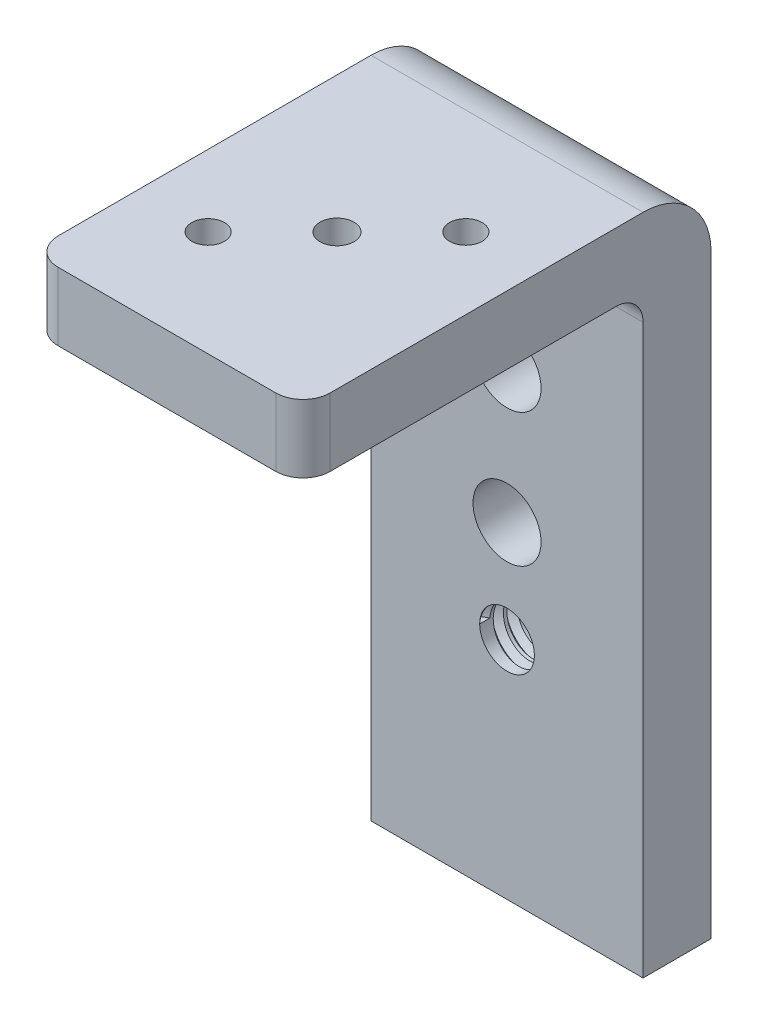
from build123d import *

# Parameters (mm, degrees)
BOSS_EXTRUDE1_DEPTH         = 3.175
SKETCH14_W                  = 25.4
SKETCH14_H                  = 6.35
BOSS_EXTRUDE2_DEPTH         = 31.75
F_1_4_0_25_DIAMETER_HOLE1_D = 6.35
F_1_4_20_TAPPED_HOLE1_D     = 5.1054
THREAD1_PITCH               = 1.27
FILLET1_R                   = 6.35
FILLET2_R                   = 2.54
SKETCH23_R                  = 1.524
CUT_EXTRUDE2_DEPTH          = 73.209440492


with BuildPart() as part:
    # Sketch1 → Boss-Extrude1 (new, symmetric)
    with BuildSketch(Plane.XY):
        Polygon((-12.7, 0), (12.7, 0), (12.7, 42.8625), (12.7, 61.9125), (-12.7, 61.9125), (-12.7, 42.8625), align=None)
    extrude(amount=BOSS_EXTRUDE1_DEPTH, both=True)

    # Sketch14 → Boss-Extrude2 (add)
    with BuildSketch(Plane.XY.offset(3.175)):
        with Locations((0, 58.7375)):
            Rectangle(SKETCH14_W, SKETCH14_H)
    extrude(amount=BOSS_EXTRUDE2_DEPTH)

    # 1/4 (0.25) Diameter Hole1 (through all)
    with Locations(Plane.XY.offset(3.175)):
        with Locations((0, 42.926), (0, 30.48)):
            Hole(F_1_4_0_25_DIAMETER_HOLE1_D / 2)

    # 1/4-20 Tapped Hole1 (through all)
    with Locations(Plane.XY.offset(3.175)):
        with Locations((0, 21.0058)):
            Hole(F_1_4_20_TAPPED_HOLE1_D / 2)

    # Thread1: the profile of Thread Profile1 profile screwed along a right-hand helix of 5 turns, 8 arcs to a turn; built about Z, then put on its axis
    thread1_z = Axis((0, 0, 0), (0, 0, 1))
    thread1_corners = [(2.5524, 0, -0.000173205), (3.240107661, 0, 0.396874998), (3.240107661, 0, 0.555624998), (2.5524, 0, 0.952673202)]
    with BuildLine(mode=Mode.PRIVATE) as thread1_profile:
        Line(thread1_corners[0], thread1_corners[1])
        Line(thread1_corners[1], thread1_corners[2])
        Line(thread1_corners[2], thread1_corners[3])
        Line(thread1_corners[3], thread1_corners[0])
    thread1_cap = Face(thread1_profile.wire())
    thread1_turn_angles = [0, 22.5, 45, 67.5, 90, 112.5, 135, 157.5, 180, 202.5, 225, 247.5, 270, 292.5, 315, 337.5, 360]
    thread1_turn_weights = [1, 0.9238795325112867, 1, 0.9238795325112867, 1, 0.9238795325112867, 1, 0.9238795325112867, 1, 0.9238795325112867, 1, 0.9238795325112867, 1, 0.9238795325112867, 1, 0.9238795325112867, 1]
    thread1_turn_rails = [Edge.make_bspline([Vector(p[0], p[1], 0).rotate(thread1_z, thread1_turn_angles[k]) / thread1_turn_weights[k] + Vector(0, 0, p[2] + THREAD1_PITCH * thread1_turn_angles[k] / 360) for k in range(17)], [0, 0, 0, 1, 1, 2, 2, 3, 3, 4, 4, 5, 5, 6, 6, 7, 7, 8, 8, 8], 2, thread1_turn_weights) for p in thread1_corners]
    thread1_turn_sides = [Face.make_surface_from_curves(thread1_turn_rails[p[0]], thread1_turn_rails[p[1]]) for p in [(0, 1), (1, 2), (2, 3), (3, 0)]]
    thread1 = Plane(origin=(0, 21.0058, 3.175), x_dir=(-1, 0, 0), z_dir=(0, 0, -1)) * Solid(Shell([*[p.moved(Location((0, 0, THREAD1_PITCH * i))) for i in range(5) for p in thread1_turn_sides], thread1_cap, thread1_cap.rotate(thread1_z, 1800).moved(Location((0, 0, THREAD1_PITCH * 1800 / 360)))]))
    add(thread1, mode=Mode.SUBTRACT)

    # Fillet1
    fillet1_edges = [part.edges().sort_by_distance(p)[0] for p in [
        (0, 61.9125, -3.175),
    ]]
    fillet(fillet1_edges, radius=FILLET1_R)

    # Fillet2
    fillet2_edges = [part.edges().sort_by_distance(p)[0] for p in [
        (0, 55.5625, 3.175),
        (-12.7, 58.7375, 34.925),
        (12.7, 58.7375, 34.925),
    ]]
    fillet(fillet2_edges, radius=FILLET2_R)

    # Sketch23 → Cut-Extrude2 (cut, through all)
    with BuildSketch(Plane(origin=(0, 61.9125, 0), x_dir=(1, 0, 0), z_dir=(0, 1, 0))):
        with Locations(Location((-6.016771601, -25.066771601, 0), (0, 0, 180))):
            Circle(SKETCH23_R)
        with Locations(Location((6.016771601, -13.033228399, 0), (0, 0, 180))):
            Circle(SKETCH23_R)
        with BuildLine():
            ThreePointArc((1.315232014, -18.161), (0, -17.4625), (-1.315232014, -18.161))
            ThreePointArc((-1.315232014, -18.161), (0, -20.6375), (1.315232014, -18.161))
        make_face()
    extrude(amount=-CUT_EXTRUDE2_DEPTH, mode=Mode.SUBTRACT)


solid = part.part
